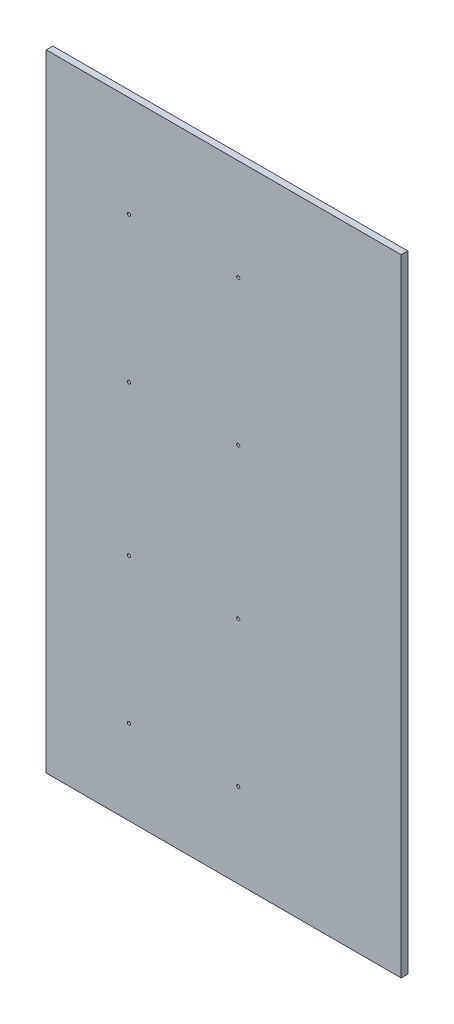
from build123d import *

# Parameters (mm, degrees)
SKETCH1_W        = 340
SKETCH1_H        = 600
SHEET_DEPTH      = 6.35
HOLES_DEPTH      = 690.666819921
HOLES_DEPTH_BACK = 690.666819921
SKETCH2_R        = 1.5


with BuildPart() as part:
    # Sketch1 → Sheet (new body)
    with BuildSketch(Plane.XY):
        with Locations((170, 300)):
            Rectangle(SKETCH1_W, SKETCH1_H)
    extrude(amount=SHEET_DEPTH)

    # Sketch2 → Holes (cut, two sides: drawn at the far end of the back side and taken through both)
    with BuildSketch(Plane.XY.offset(-HOLES_DEPTH_BACK)):
        with Locations((183.95, 80.9)):
            Circle(SKETCH2_R)
        with Locations((79.25, 80.9)):
            Circle(SKETCH2_R)
        with Locations((183.95, 220.033)):
            Circle(SKETCH2_R)
        with Locations((79.25, 220.033)):
            Circle(SKETCH2_R)
        with Locations((183.95, 363.967)):
            Circle(SKETCH2_R)
        with Locations((79.25, 363.967)):
            Circle(SKETCH2_R)
        with Locations((183.95, 503.1)):
            Circle(SKETCH2_R)
        with Locations((79.25, 503.1)):
            Circle(SKETCH2_R)
    extrude(amount=HOLES_DEPTH + HOLES_DEPTH_BACK, mode=Mode.SUBTRACT)


solid = part.part
